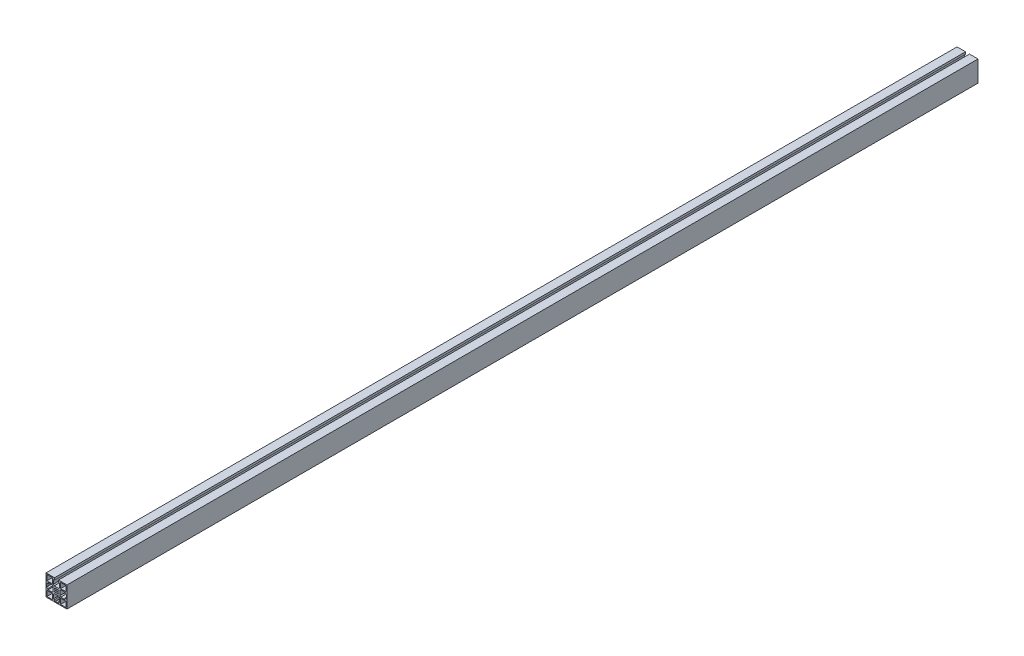
from build123d import *

# Parameters (mm, degrees)
SKETCH1_W           = 11.699975178
SKETCH1_H           = 11.699996949
SKETCH1_W_2         = 11.699990436
SKETCH1_H_2         = 11.699981689
SKETCH1_W_3         = 11.699990437
SKETCH1_H_3         = 11.699975177
SKETCH1_W_4         = 11.699981689
SKETCH1_H_4         = 11.699990436
BOSS_EXTRUDE1_DEPTH = 1955.8


with BuildPart() as part:
    # Sketch1 → Boss-Extrude1 (new body)
    with BuildSketch(Plane.XY):
        Polygon((-4.249491247, 17.999291576), (-4.249490956, 22.199304807), (-4.249490956, 22.499297883), (-22.499484399, 22.499298105), (-22.499484948, -22.500701346), (22.500514502, -22.500701895), (22.500515052, 22.499297556), (4.250509108, 22.499297779), (4.250509108, 22.199304487), (4.250508817, 17.999291575), (6.800527063, 17.999291575), (6.800526453, 9.199302988), (4.800526064, 7.199302969), (-4.799479817, 7.199303635), (-6.799479854, 9.199304042), (-6.799479244, 17.999291576), align=None)
        with Locations((-14.649542346, -14.650709384)):
            Rectangle(SKETCH1_W, SKETCH1_H, mode=Mode.SUBTRACT)
        with BuildLine():
            Line((-22.199510799, -4.250714391), (-22.199510799, -3.950696126))
            Line((-22.199510799, -3.950696126), (-21.731790056, -3.48300681))
            ThreePointArc((-21.731790056, -3.48300681), (-21.189814855, -2.671927844), (-20.999497617, -1.71518046))
            Line((-20.999497617, -1.71518046), (-20.999497617, 1.713721031))
            ThreePointArc((-20.999497617, 1.713721031), (-21.189799286, 2.670430863), (-21.731732544, 3.481489907))
            Line((-21.731732544, 3.481489907), (-22.199510888, 3.949267256))
            Line((-22.199510888, 3.949267256), (-22.199510888, 4.249285566))
            Line((-22.199510888, 4.249285566), (-17.999497356, 4.249285704))
            Line((-17.999497356, 4.249285704), (-17.999497356, 6.79927354))
            Line((-17.999497356, 6.79927354), (-9.199509947, 6.799273828))
            Line((-9.199509947, 6.799273828), (-7.199509956, 4.799274012))
            Line((-7.199509956, 4.799274012), (-7.199509641, -4.800732197))
            Line((-7.199509641, -4.800732197), (-9.199509449, -6.800732179))
            Line((-9.199509449, -6.800732179), (-17.99949762, -6.800732468))
            Line((-17.99949762, -6.800732468), (-17.99949762, -4.250714253))
            Line((-17.99949762, -4.250714253), (-22.199510799, -4.250714391))
        make_face(mode=Mode.SUBTRACT)
        with BuildLine():
            Line((-4.24949208, -18.000719999), (-6.799479919, -18.000719999))
            Line((-6.799479919, -18.000719999), (-6.799480207, -9.200732353))
            Line((-6.799480207, -9.200732353), (-4.799480391, -7.200732362))
            Line((-4.799480391, -7.200732362), (4.800525817, -7.200732047))
            Line((4.800525817, -7.200732047), (6.8005258, -9.200731855))
            Line((6.8005258, -9.200731855), (6.800526088, -18.000720263))
            Line((6.800526088, -18.000720263), (4.250507877, -18.000720263))
            Line((4.250507877, -18.000720263), (4.250508015, -22.200733153))
            Line((4.250508015, -22.200733153), (3.950489751, -22.200733153))
            Line((3.950489751, -22.200733153), (3.482800434, -21.73301241))
            ThreePointArc((3.482800434, -21.73301241), (2.671721468, -21.191037209), (1.714974084, -21.000719971))
            Line((1.714974084, -21.000719971), (-1.713927407, -21.000719971))
            ThreePointArc((-1.713927407, -21.000719971), (-2.670637239, -21.19102164), (-3.481696283, -21.732954898))
            Line((-3.481696283, -21.732954898), (-3.949473632, -22.200733242))
            Line((-3.949473632, -22.200733242), (-4.249491942, -22.200733242))
            Line((-4.249491942, -22.200733242), (-4.24949208, -18.000719999))
        make_face(mode=Mode.SUBTRACT)
        with Locations((14.65050626, -14.650767962)):
            Rectangle(SKETCH1_W_2, SKETCH1_H_2, mode=Mode.SUBTRACT)
        with BuildLine():
            Line((-3.181457266, -4.596908447), (-4.595670829, -3.182694885))
            Line((-4.595670829, -3.182694885), (-3.26221457, -1.849238626))
            ThreePointArc((-3.26221457, -1.849238626), (-3.749476751, -0.00071437), (-3.26221457, 1.847809887))
            Line((-3.26221457, 1.847809887), (-4.595670829, 3.181266146))
            Line((-4.595670829, 3.181266146), (-3.181457266, 4.595479708))
            Line((-3.181457266, 4.595479708), (-1.848001007, 3.262023449))
            ThreePointArc((-1.848001007, 3.262023449), (0.000523249, 3.74928563), (1.849047505, 3.262023449))
            Line((1.849047505, 3.262023449), (3.182503764, 4.595479708))
            Line((3.182503764, 4.595479708), (4.596717327, 3.181266146))
            Line((4.596717327, 3.181266146), (3.263261068, 1.847809887))
            ThreePointArc((3.263261068, 1.847809887), (3.750523249, -0.00071437), (3.263261068, -1.849238626))
            Line((3.263261068, -1.849238626), (4.596717327, -3.182694885))
            Line((4.596717327, -3.182694885), (3.182503764, -4.596908447))
            Line((3.182503764, -4.596908447), (1.849047505, -3.263452188))
            ThreePointArc((1.849047505, -3.263452188), (0.000523249, -3.75071437), (-1.848001007, -3.263452188))
            Line((-1.848001007, -3.263452188), (-3.181457266, -4.596908447))
        make_face(mode=Mode.SUBTRACT)
        with Locations((-14.64949028, 14.649335967)):
            Rectangle(SKETCH1_W_3, SKETCH1_H_3, mode=Mode.SUBTRACT)
        with BuildLine():
            Line((9.200519462, -6.800702567), (7.200519471, -4.800702751))
            Line((7.200519471, -4.800702751), (7.200519156, 4.799303458))
            Line((7.200519156, 4.799303458), (9.200518964, 6.79930344))
            Line((9.200518964, 6.79930344), (18.000507424, 6.799303729))
            Line((18.000507424, 6.799303729), (18.000507424, 4.249285514))
            Line((18.000507424, 4.249285514), (22.200520261, 4.249285652))
            Line((22.200520261, 4.249285652), (22.200520261, 3.949267391))
            Line((22.200520261, 3.949267391), (21.732799519, 3.481578075))
            ThreePointArc((21.732799519, 3.481578075), (21.190824318, 2.670499108), (21.000507079, 1.713751724))
            Line((21.000507079, 1.713751724), (21.000507079, -1.715149766))
            ThreePointArc((21.000507079, -1.715149766), (21.190808749, -2.671859599), (21.732742007, -3.482918643))
            Line((21.732742007, -3.482918643), (22.200520351, -3.950695992))
            Line((22.200520351, -3.950695992), (22.200520351, -4.250714302))
            Line((22.200520351, -4.250714302), (18.000507108, -4.25071444))
            Line((18.000507108, -4.25071444), (18.000507108, -6.800702279))
            Line((18.000507108, -6.800702279), (9.200519462, -6.800702567))
        make_face(mode=Mode.SUBTRACT)
        with Locations((14.650561583, 14.6492839)):
            Rectangle(SKETCH1_W_4, SKETCH1_H_4, mode=Mode.SUBTRACT)
    extrude(amount=BOSS_EXTRUDE1_DEPTH)


solid = part.part
